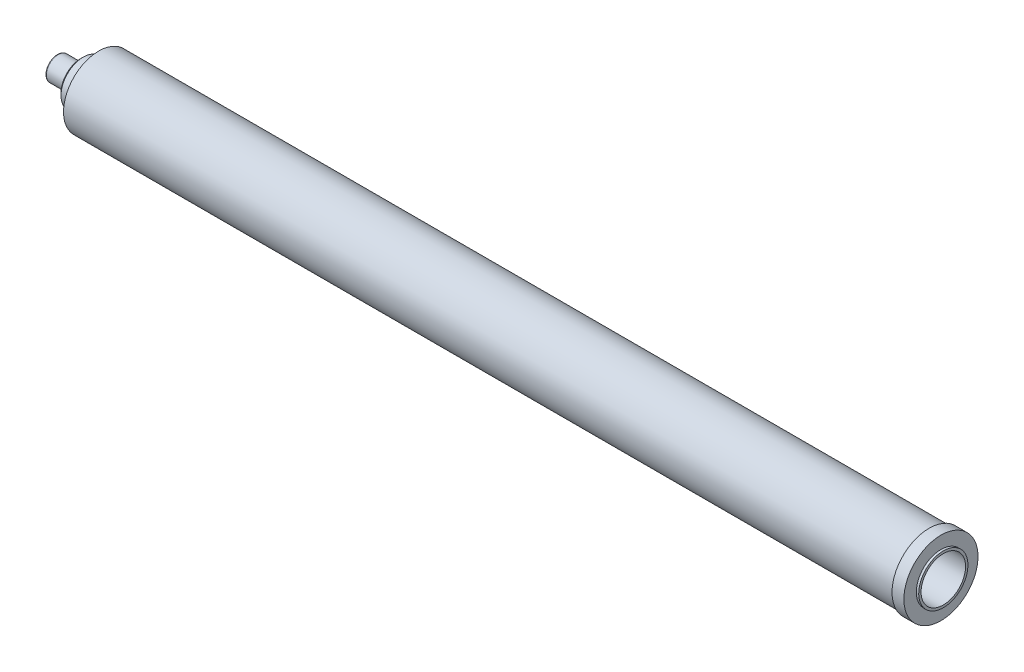
from build123d import *

# Parameters (mm, degrees)
CHAMFER1_SIZE                                       = 2.54
CSK_FOR_3_8_FLAT_HEAD_MACHINE_SCREW_100_D           = 10.0838
CSK_FOR_3_8_FLAT_HEAD_MACHINE_SCREW_100_DEPTH       = 25.4
CSK_FOR_3_8_FLAT_HEAD_MACHINE_SCREW_100_CSINK_D     = 19.3548
CSK_FOR_3_8_FLAT_HEAD_MACHINE_SCREW_100_CSINK_ANGLE = 100
CSK_FOR_3_8_FLAT_HEAD_MACHINE_SCREW_100_TIP         = 3.029479155
FILLET2_R                                           = 1.27
BOSS_EXTRUDE1_START                                 = 2.54
SKETCH5_R                                           = 26.3525
SKETCH5_R_2                                         = 23.8125
BOSS_EXTRUDE1_DEPTH                                 = 2.54
SKETCH6_R                                           = 23.8125
CUT_EXTRUDE1_DEPTH                                  = 508


with BuildPart() as part:
    # Sketch1 → Revolve1 (revolve)
    with BuildSketch(Plane.XY):
        Polygon((0, 0), (0, 12.7), (25.4, 12.7), (25.4, 23.8125), (44.45, 23.8125), (44.45, 37.6555), (933.45, 37.6555), (933.45, 39.6875), (946.15, 39.6875), (946.15, 0), align=None)
    revolve(axis=Axis((946.15, 0, 0), (-1, 0, 0)))

    # Chamfer1
    chamfer1_edges = [part.edges().sort_by_distance(p)[0] for p in [
        (25.4, -23.8125, 0),
    ]]
    chamfer(chamfer1_edges, length=CHAMFER1_SIZE)

    # CSK for 3/8 Flat Head Machine Screw (100)1
    with Locations(Plane.ZY):
        with Locations((0, 0)):
            CounterSinkHole(CSK_FOR_3_8_FLAT_HEAD_MACHINE_SCREW_100_D / 2, CSK_FOR_3_8_FLAT_HEAD_MACHINE_SCREW_100_CSINK_D / 2, depth=CSK_FOR_3_8_FLAT_HEAD_MACHINE_SCREW_100_DEPTH, counter_sink_angle=CSK_FOR_3_8_FLAT_HEAD_MACHINE_SCREW_100_CSINK_ANGLE)
            with Locations((0, 0, -(CSK_FOR_3_8_FLAT_HEAD_MACHINE_SCREW_100_DEPTH + CSK_FOR_3_8_FLAT_HEAD_MACHINE_SCREW_100_TIP / 2))):  # 118° drill point
                Cone(0, CSK_FOR_3_8_FLAT_HEAD_MACHINE_SCREW_100_D / 2, CSK_FOR_3_8_FLAT_HEAD_MACHINE_SCREW_100_TIP, mode=Mode.SUBTRACT)

    # Fillet2
    fillet2_edges = [part.edges().sort_by_distance(p)[0] for p in [
        (0, -12.7, 0),
    ]]
    fillet(fillet2_edges, radius=FILLET2_R)

    # Sketch5 → Boss-Extrude1 (add)
    with BuildSketch(Plane(origin=(946.15, 0, 0), x_dir=(0, 0, -1), z_dir=(1, 0, 0)).offset(BOSS_EXTRUDE1_START)):
        Circle(SKETCH5_R)
        Circle(SKETCH5_R_2, mode=Mode.SUBTRACT)
    extrude(amount=-BOSS_EXTRUDE1_DEPTH)

    # Sketch6 → Cut-Extrude1 (cut)
    with BuildSketch(Plane(origin=(948.69, 0, 0), x_dir=(0, 0, -1), z_dir=(1, 0, 0))):
        Circle(SKETCH6_R)
    extrude(amount=-CUT_EXTRUDE1_DEPTH, mode=Mode.SUBTRACT)


solid = part.part
